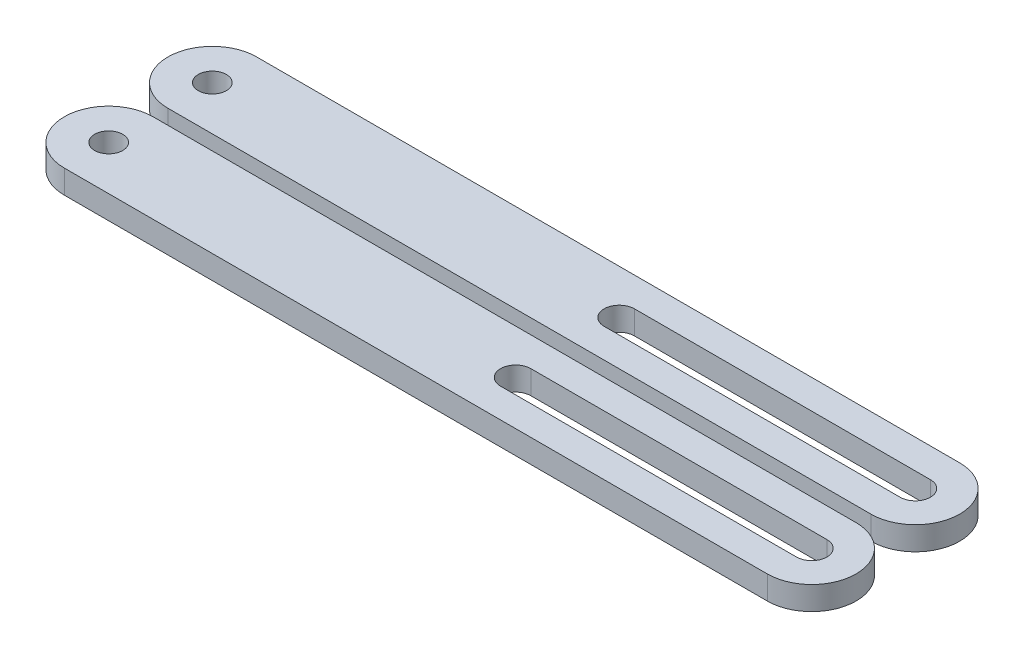
from build123d import *

# Parameters (mm, degrees)
SKETCH1_R           = 1.9
BOSS_EXTRUDE1_DEPTH = 3.175
LPATTERN1_COUNT     = 2
LPATTERN1_PITCH     = 14


with BuildPart() as part:
    # Sketch1 → Boss-Extrude1 (new body)
    with BuildSketch(Plane(origin=(0, 0, 0), x_dir=(1, 0, 0), z_dir=(0, 1, 0))):
        with BuildLine():
            Line((0, 6), (95, 6))
            ThreePointArc((95, 6), (101, 0), (95, -6))
            Line((95, -6), (0, -6))
            ThreePointArc((0, -6), (-6, 0), (0, 6))
        make_face()
        Circle(SKETCH1_R, mode=Mode.SUBTRACT)
        with BuildLine():
            Line((55, 2.05), (95, 2.05))
            ThreePointArc((95, 2.05), (97.05, 0), (95, -2.05))
            Line((95, -2.05), (55, -2.05))
            ThreePointArc((55, -2.05), (52.95, 0), (55, 2.05))
        make_face(mode=Mode.SUBTRACT)
    extrude(amount=BOSS_EXTRUDE1_DEPTH)


with BuildPart() as lpattern1_1:
    # LPattern1: pattern copy
    add(part.part.moved(Location(Vector(0, 0, -1) * (1 * LPATTERN1_PITCH))))


solid = Compound([part.part, lpattern1_1.part])
